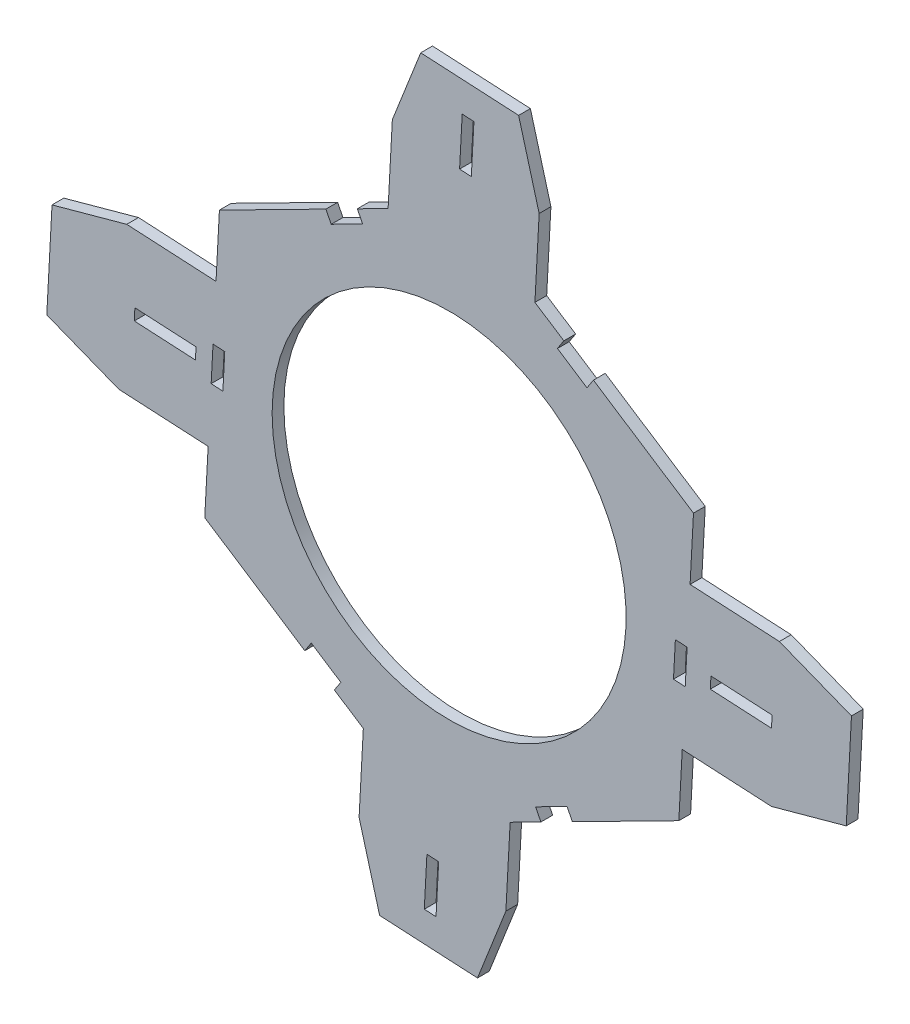
from build123d import *
from OCP.BRepFilletAPI import BRepFilletAPI_MakeChamfer

# Parameters (mm, degrees)
SKETCH1_R           = 22.936303849
BOSS_EXTRUDE1_DEPTH = 1.524
CHAMFER1_SIZE       = 9.525
CHAMFER1_SIZE2      = 3.175
CHAMFER2_SIZE       = 3.175
CHAMFER2_SIZE2      = 9.525
CUT_EXTRUDE1_DEPTH  = 2.54


with BuildPart() as part:
    # Sketch1 → Boss-Extrude1 (new body)
    with BuildSketch(Plane.XY):
        Polygon((100.704172568, 45.414246453), (81.681455777, 46.433435282), (80.622849682, 26.675012358), (76.63481241, 24.648861707), (77.325109608, 23.290161674), (73.249009511, 21.219270079), (72.558712313, 22.577970112), (58.765102173, 15.570028545), (58.324644283, 7.349073351), (37.244990665, 8.478467628), (36.225801836, -10.544249163), (57.305455454, -11.673643441), (56.864997564, -19.894598635), (69.830858059, -28.336244643), (70.662378204, -27.059079717), (74.493872982, -29.553640152), (73.662352837, -30.830805078), (77.411069409, -33.271471342), (76.352463315, -53.029894266), (95.375180107, -54.049083095), (96.433786201, -34.290660171), (100.421823473, -32.264509519), (99.731526275, -30.905809487), (103.807626372, -28.834917892), (104.49792357, -30.193617925), (118.291533711, -23.185676358), (118.731991601, -14.964721163), (139.811645218, -16.094115441), (140.830834047, 2.928601351), (119.75118043, 4.057995628), (120.19163832, 12.278950822), (107.225777824, 20.72059683), (106.394257679, 19.443431904), (102.562762901, 21.937992339), (103.394283046, 23.215157266), (99.645566474, 25.655823529), align=None)
        Polygon((119.363888675, -3.170636753), (119.119283356, -7.736088783), (117.597466012, -7.654553676), (117.842071331, -3.089101646), align=None, mode=Mode.SUBTRACT)
        Polygon((57.692747209, -4.44501106), (57.937352528, 0.12044097), (59.459169871, 0.038905863), (59.214564552, -4.526546167), align=None, mode=Mode.SUBTRACT)
        with Locations((88.528317942, -3.807823906)):
            Circle(SKETCH1_R, mode=Mode.SUBTRACT)
    extrude(amount=BOSS_EXTRUDE1_DEPTH)

    # Chamfer1: one chamfer whose edges measure the first distance from different faces: ONE call of the kernel's chamfer builder (chamfer() names one face for all edges)
    chamfer1_edges_1 = [part.edges().sort_by_distance(p)[0] for p in [
        (37.244990665, 8.478467628, 0.762),
    ]]
    chamfer1_side_1 = [part.faces().sort_by_distance(p)[0] for p in [
        (47.784817474, 7.913770489, 0.762),
    ]]
    chamfer1_edges_2 = [part.edges().sort_by_distance(p)[0] for p in [
        (100.704172568, 45.414246453, 0.762),
    ]]
    chamfer1_side_2 = [part.faces().sort_by_distance(p)[0] for p in [
        (100.174869521, 35.535034991, 0.762),
    ]]
    chamfer1_edges_3 = [part.edges().sort_by_distance(p)[0] for p in [
        (139.811645218, -16.094115441, 0.762),
    ]]
    chamfer1_side_3 = [part.faces().sort_by_distance(p)[0] for p in [
        (129.27181841, -15.529418302, 0.762),
    ]]
    chamfer1_edges_4 = [part.edges().sort_by_distance(p)[0] for p in [
        (76.352463315, -53.029894266, 0.762),
    ]]
    chamfer1_side_4 = [part.faces().sort_by_distance(p)[0] for p in [
        (76.881766362, -43.150682804, 0.762),
    ]]
    chamfer1 = BRepFilletAPI_MakeChamfer(part.part.solid().wrapped)
    for e in chamfer1_edges_1:
        chamfer1.Add(CHAMFER1_SIZE, CHAMFER1_SIZE2, e.wrapped, chamfer1_side_1[0].wrapped)  # the first distance lies on this face
    for e in chamfer1_edges_2:
        chamfer1.Add(CHAMFER1_SIZE, CHAMFER1_SIZE2, e.wrapped, chamfer1_side_2[0].wrapped)  # the first distance lies on this face
    for e in chamfer1_edges_3:
        chamfer1.Add(CHAMFER1_SIZE, CHAMFER1_SIZE2, e.wrapped, chamfer1_side_3[0].wrapped)  # the first distance lies on this face
    for e in chamfer1_edges_4:
        chamfer1.Add(CHAMFER1_SIZE, CHAMFER1_SIZE2, e.wrapped, chamfer1_side_4[0].wrapped)  # the first distance lies on this face
    add(Compound.cast(chamfer1.Shape()), mode=Mode.REPLACE)

    # Chamfer2: one chamfer whose edges measure the first distance from different faces: ONE call of the kernel's chamfer builder (chamfer() names one face for all edges)
    chamfer2_edges_1 = [part.edges().sort_by_distance(p)[0] for p in [
        (81.681455777, 46.433435282, 0.762),
    ]]
    chamfer2_side_1 = [part.faces().sort_by_distance(p)[0] for p in [
        (89.607587773, 46.00877327, 0.762),
    ]]
    chamfer2_edges_2 = [part.edges().sort_by_distance(p)[0] for p in [
        (140.830834047, 2.928601351, 0.762),
    ]]
    chamfer2_side_2 = [part.faces().sort_by_distance(p)[0] for p in [
        (140.406172035, -4.997530646, 0.762),
    ]]
    chamfer2_edges_3 = [part.edges().sort_by_distance(p)[0] for p in [
        (95.375180107, -54.049083095, 0.762),
    ]]
    chamfer2_side_3 = [part.faces().sort_by_distance(p)[0] for p in [
        (87.44904811, -53.624421082, 0.762),
    ]]
    chamfer2_edges_4 = [part.edges().sort_by_distance(p)[0] for p in [
        (36.225801836, -10.544249163, 0.762),
    ]]
    chamfer2_side_4 = [part.faces().sort_by_distance(p)[0] for p in [
        (36.650463848, -2.618117167, 0.762),
    ]]
    chamfer2 = BRepFilletAPI_MakeChamfer(part.part.solid().wrapped)
    for e in chamfer2_edges_1:
        chamfer2.Add(CHAMFER2_SIZE, CHAMFER2_SIZE2, e.wrapped, chamfer2_side_1[0].wrapped)  # the first distance lies on this face
    for e in chamfer2_edges_2:
        chamfer2.Add(CHAMFER2_SIZE, CHAMFER2_SIZE2, e.wrapped, chamfer2_side_2[0].wrapped)  # the first distance lies on this face
    for e in chamfer2_edges_3:
        chamfer2.Add(CHAMFER2_SIZE, CHAMFER2_SIZE2, e.wrapped, chamfer2_side_3[0].wrapped)  # the first distance lies on this face
    for e in chamfer2_edges_4:
        chamfer2.Add(CHAMFER2_SIZE, CHAMFER2_SIZE2, e.wrapped, chamfer2_side_4[0].wrapped)  # the first distance lies on this face
    add(Compound.cast(chamfer2.Shape()), mode=Mode.REPLACE)

    # Sketch4 → Cut-Extrude1 (cut)
    with BuildSketch(Plane.XY.offset(1.524)):
        Polygon((91.405442047, 35.64965039), (91.745171657, 41.990555987), (90.223354313, 42.072091094), (89.883624704, 35.731185497), align=None)
        Polygon((122.371271261, -6.384136244), (130.297403257, -6.808798256), (130.378938364, -5.286980913), (122.452806367, -4.862318901), align=None)
        Polygon((85.651193836, -43.265298203), (85.311464227, -49.6062038), (86.83328157, -49.687738907), (87.17301118, -43.346833309), align=None)
        Polygon((55.738296259, -1.28792497), (47.812164263, -0.863262958), (47.730629156, -2.385080302), (55.656761153, -2.809742314), align=None)
    extrude(amount=-CUT_EXTRUDE1_DEPTH, mode=Mode.SUBTRACT)


solid = part.part
